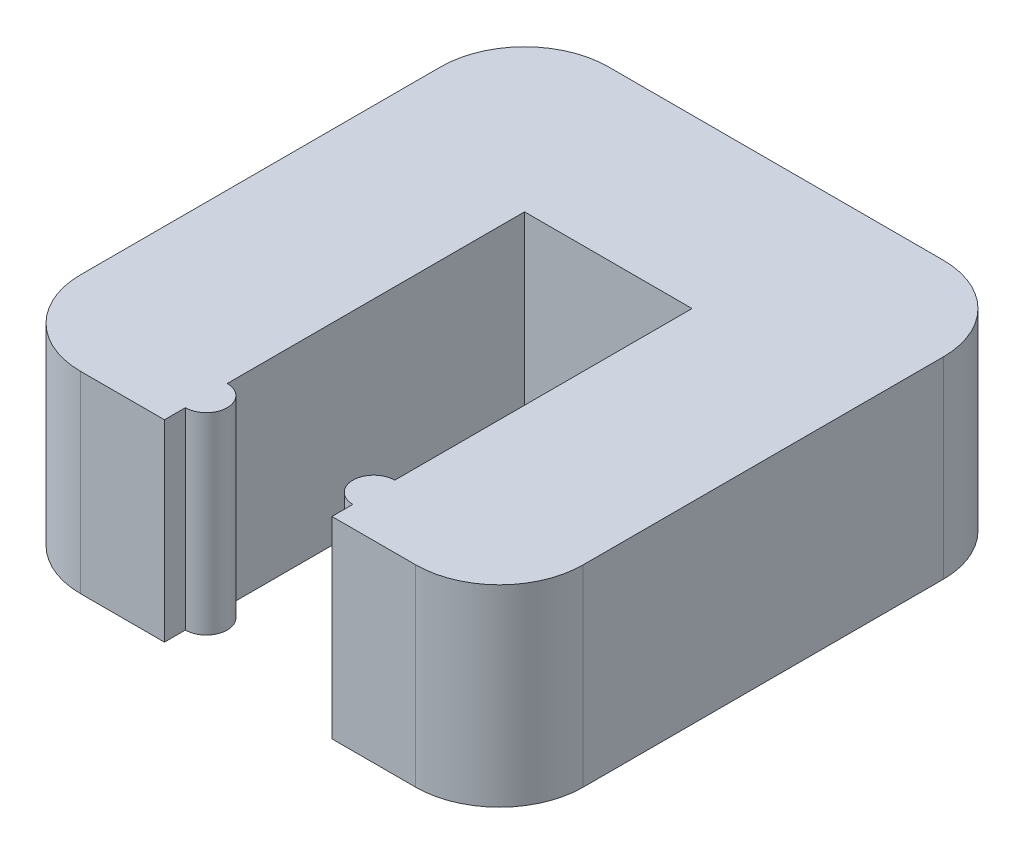
from build123d import *

# Parameters (mm, degrees)
BASE_FLANGE1_DEPTH = 2.3
TAB1_DEPTH         = 2.3


# Sheet-metal steps are written as plain solids
with BuildPart() as part:
    # Sketch1 → Base-Flange1 (new body)
    with BuildSketch(Plane(origin=(0, 0, 0), x_dir=(1, 0, 0), z_dir=(0, 1, 0))):
        with BuildLine():
            Line((-1, -2.15), (-2, -2.15))
            ThreePointArc((-2, -2.15), (-2.707106781, -1.857106781), (-3, -1.15))
            Line((-3, -1.15), (-3, 3.15))
            ThreePointArc((-3, 3.15), (-2.707106781, 3.857106781), (-2, 4.15))
            Line((-2, 4.15), (2, 4.15))
            ThreePointArc((2, 4.15), (2.707106781, 3.857106781), (3, 3.15))
            Line((3, 3.15), (3, -1.15))
            ThreePointArc((3, -1.15), (2.707106781, -1.857106781), (2, -2.15))
            Line((2, -2.15), (1, -2.15))
            Line((1, -2.15), (1, 2.15))
            Line((1, 2.15), (-1, 2.15))
            Line((-1, 2.15), (-1, -2.15))
        make_face()
    extrude(amount=-BASE_FLANGE1_DEPTH)

    # Sketch6 → Tab1 (add)
    with BuildSketch(Plane(origin=(0, 0, 0), x_dir=(1, 0, 0), z_dir=(0, 1, 0))):
        with BuildLine():
            Line((-1, -1.9), (-1, -1.4))
            ThreePointArc((-1, -1.4), (-0.75, -1.65), (-1, -1.9))
        make_face()
        with BuildLine():
            Line((1, -1.9), (1, -1.4))
            ThreePointArc((1, -1.4), (0.75, -1.65), (1, -1.9))
        make_face()
    extrude(amount=-TAB1_DEPTH)


solid = part.part
